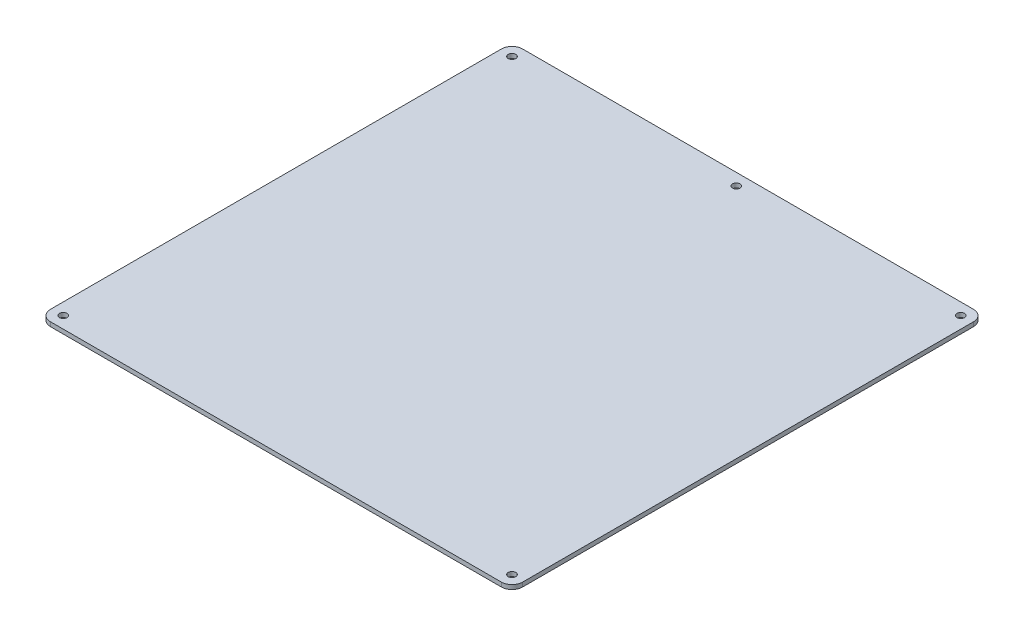
from build123d import *

# Parameters (mm, degrees)
SKETCH_1_R      = 1.75
EXTRUDE_1_DEPTH = 2


with BuildPart() as part:
    # Эскиз1 → Бобышка-Вытянуть1 (new body)
    with BuildSketch(Plane(origin=(0, 0, 0), x_dir=(1, 0, 0), z_dir=(0, 1, 0))):
        with BuildLine():
            Line((-105, 110), (105, 110))
            ThreePointArc((105, 110), (108.535533906, 108.535533906), (110, 105))
            Line((110, 105), (110, -105))
            ThreePointArc((110, -105), (108.535533906, -108.535533906), (105, -110))
            Line((105, -110), (-105, -110))
            ThreePointArc((-105, -110), (-108.535533906, -108.535533906), (-110, -105))
            Line((-110, -105), (-110, 105))
            ThreePointArc((-110, 105), (-108.535533906, 108.535533906), (-105, 110))
        make_face()
        with Locations((104.5, 104.5)):
            Circle(SKETCH_1_R, mode=Mode.SUBTRACT)
        with Locations((104.5, -104.5)):
            Circle(SKETCH_1_R, mode=Mode.SUBTRACT)
        with Locations((0, 104.5)):
            Circle(SKETCH_1_R, mode=Mode.SUBTRACT)
        with Locations((-104.5, 104.5)):
            Circle(SKETCH_1_R, mode=Mode.SUBTRACT)
        with Locations((-104.5, -104.5)):
            Circle(SKETCH_1_R, mode=Mode.SUBTRACT)
    extrude(amount=EXTRUDE_1_DEPTH)


solid = part.part
